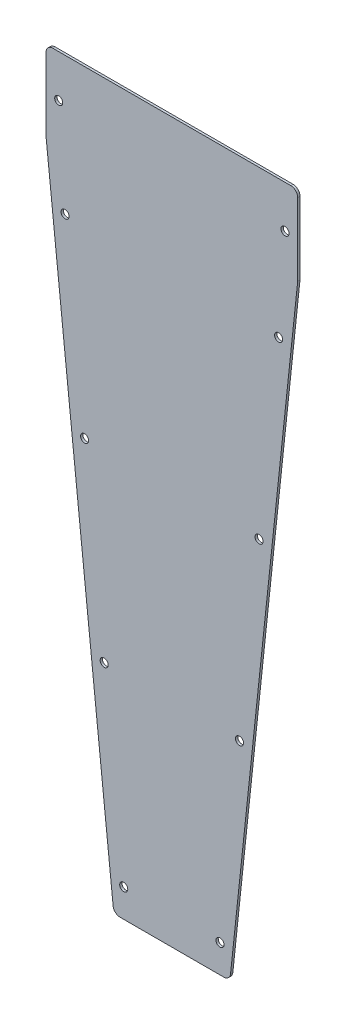
from build123d import *

# Parameters (mm, degrees)
ESBO_O1_R          = 3.5
FLANGE_BASE1_DEPTH = 2


# Sheet-metal steps are written as plain solids
with BuildPart() as part:
    # Esboço1 → Flange-base1 (new body)
    with BuildSketch(Plane.XY):
        with BuildLine():
            Line((-44.875, 0), (44.875, 0))
            ThreePointArc((44.875, 0), (48.887773278, 1.539321731), (50.84156352, 5.367449793))
            Line((50.84156352, 5.367449793), (109, 553.95))
            Line((109, 553.95), (109, 616.76))
            ThreePointArc((109, 616.76), (107.242640687, 621.002640687), (103, 622.76))
            Line((103, 622.76), (-103, 622.76))
            ThreePointArc((-103, 622.76), (-107.242640687, 621.002640687), (-109, 616.76))
            Line((-109, 616.76), (-109, 553.95))
            Line((-109, 553.95), (-50.84156352, 5.367449793))
            ThreePointArc((-50.84156352, 5.367449793), (-48.887773278, 1.539321731), (-44.875, 0))
        make_face()
        with Locations((-98, 586.08)):
            Circle(ESBO_O1_R, mode=Mode.SUBTRACT)
        with Locations((98, 586.08)):
            Circle(ESBO_O1_R, mode=Mode.SUBTRACT)
        with Locations((-92.5, 503.64)):
            Circle(ESBO_O1_R, mode=Mode.SUBTRACT)
        with Locations((92.5, 503.64)):
            Circle(ESBO_O1_R, mode=Mode.SUBTRACT)
        with Locations((-75.56185023, 343.87)):
            Circle(ESBO_O1_R, mode=Mode.SUBTRACT)
        with Locations((-58.623700461, 184.1)):
            Circle(ESBO_O1_R, mode=Mode.SUBTRACT)
        with Locations((-41.685550691, 24.33)):
            Circle(ESBO_O1_R, mode=Mode.SUBTRACT)
        with Locations(Location((41.685550691, 24.33, 0), (0, 0, 180))):
            Circle(ESBO_O1_R, mode=Mode.SUBTRACT)
        with Locations(Location((58.623700461, 184.1, 0), (0, 0, 180))):
            Circle(ESBO_O1_R, mode=Mode.SUBTRACT)
        with Locations(Location((75.56185023, 343.87, 0), (0, 0, 180))):
            Circle(ESBO_O1_R, mode=Mode.SUBTRACT)
    extrude(amount=-FLANGE_BASE1_DEPTH)


solid = part.part
